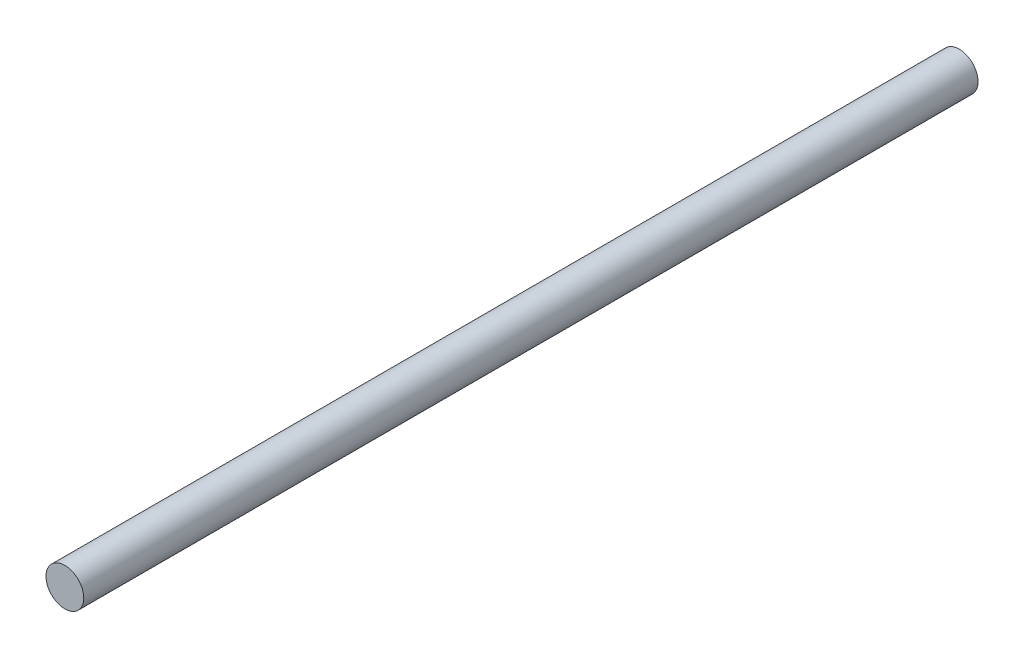
from build123d import *

# Parameters (mm, degrees)
SKETCH_1_R      = 5
EXTRUDE_1_DEPTH = 208.44
EXTRUDE_START   = 28.36
SKETCH_3_R      = 5
EXTRUDE_2_DEPTH = 28.36


with BuildPart() as part:
    # 스케치1 → 보스-돌출1 (new body)
    with BuildSketch(Plane.XY):
        Circle(SKETCH_1_R)
    extrude(amount=EXTRUDE_1_DEPTH)

    # 스케치3 → 보스-돌출2 (add)
    with BuildSketch(Plane(origin=(0, 0, 0), x_dir=(-1, 0, 0), z_dir=(0, 0, -1)).offset(EXTRUDE_START)):
        Circle(SKETCH_3_R)
    extrude(amount=-EXTRUDE_2_DEPTH)


solid = part.part
